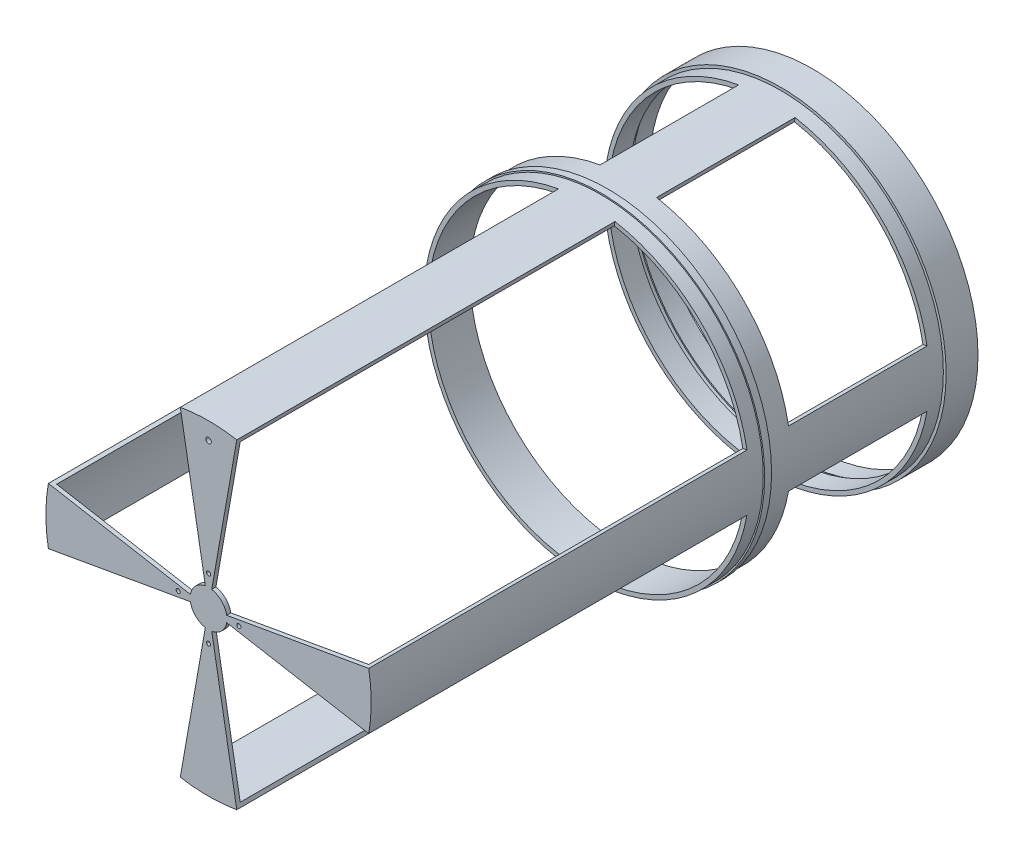
from build123d import *

# Parameters (mm, degrees)
SKETCH1_R       = 119.4
SKETCH1_R_2     = 114.4
EXTRUDE1_DEPTH  = 5
SKETCH2_R       = 119.4
SKETCH2_R_2     = 118.4
EXTRUDE2_DEPTH  = 5
SKETCH3_R       = 119.4
SKETCH3_R_2     = 117.4
EXTRUDE3_DEPTH  = 13
EXTRUDE4_START  = 10
SKETCH4_R       = 117.4
SKETCH4_R_2     = 114.4
EXTRUDE4_DEPTH  = 10
EXTRUDE5_START  = 100
EXTRUDE5_DEPTH  = 100
EXTRUDE7_START  = 15
SKETCH6_R       = 117.4
SKETCH6_R_2     = 114.4
EXTRUDE7_DEPTH  = 15
EXTRUDE8_START  = 5
SKETCH7_R       = 118.4
SKETCH7_R_2     = 114.4
EXTRUDE8_DEPTH  = 5
EXTRUDE9_START  = 10
SKETCH8_R       = 117.4
SKETCH8_R_2     = 114.4
EXTRUDE9_DEPTH  = 10
EXTRUDE10_START = 270
EXTRUDE10_DEPTH = 270
EXTRUDE11_START = 3
SKETCH10_R      = 1.5
SKETCH10_R_2    = 2
EXTRUDE11_DEPTH = 3


with BuildPart() as part:
    # Sketch1 → Extrude1 (new body)
    with BuildSketch(Plane.XY):
        Circle(SKETCH1_R)
        Circle(SKETCH1_R_2, mode=Mode.SUBTRACT)
    extrude(amount=-EXTRUDE1_DEPTH)

    # Sketch2 → Extrude2 (add)
    with BuildSketch(Plane(origin=(0, 0, -5), x_dir=(-1, 0, 0), z_dir=(0, 0, -1))):
        Circle(SKETCH2_R)
        Circle(SKETCH2_R_2, mode=Mode.SUBTRACT)
    extrude(amount=EXTRUDE2_DEPTH)

    # Sketch3 → Extrude3 (add)
    with BuildSketch(Plane(origin=(0, 0, -10), x_dir=(-1, 0, 0), z_dir=(0, 0, -1))):
        Circle(SKETCH3_R)
        Circle(SKETCH3_R_2, mode=Mode.SUBTRACT)
    extrude(amount=EXTRUDE3_DEPTH)

    # Sketch4 → Extrude4 (add)
    with BuildSketch(Plane.XY.offset(EXTRUDE4_START)):
        Circle(SKETCH4_R)
        Circle(SKETCH4_R_2, mode=Mode.SUBTRACT)
    extrude(amount=-EXTRUDE4_DEPTH)

    # Sketch5 → Extrude5 (add)
    with BuildSketch(Plane.XY.offset(10).offset(EXTRUDE5_START)):
        with BuildLine():
            Line((20.386296, 115.61643), (19.865352, 112.662007))
            ThreePointArc((19.865352, 112.662007), (0, 114.4), (-19.865352, 112.662007))
            Line((-19.865352, 112.662007), (-20.386296, 115.61643))
            ThreePointArc((-20.386296, 115.61643), (0, 117.4), (20.386296, 115.61643))
        make_face()
        with BuildLine():
            Line((115.61643, 20.386296), (112.662007, 19.865352))
            ThreePointArc((112.662007, 19.865352), (114.4, 0), (112.662007, -19.865352))
            Line((112.662007, -19.865352), (115.61643, -20.386296))
            ThreePointArc((115.61643, -20.386296), (117.4, 0), (115.61643, 20.386296))
        make_face()
        with BuildLine():
            Line((19.865352, -112.662007), (20.386296, -115.61643))
            ThreePointArc((20.386296, -115.61643), (0, -117.4), (-20.386296, -115.61643))
            Line((-20.386296, -115.61643), (-19.865352, -112.662007))
            ThreePointArc((-19.865352, -112.662007), (0, -114.4), (19.865352, -112.662007))
        make_face()
        with BuildLine():
            Line((-112.662007, -19.865352), (-115.61643, -20.386296))
            ThreePointArc((-115.61643, -20.386296), (-117.4, 0), (-115.61643, 20.386296))
            Line((-115.61643, 20.386296), (-112.662007, 19.865352))
            ThreePointArc((-112.662007, 19.865352), (-114.4, 0), (-112.662007, -19.865352))
        make_face()
    extrude(amount=-EXTRUDE5_DEPTH)

    # Sketch6 → Extrude7 (add)
    with BuildSketch(Plane.XY.offset(110).offset(EXTRUDE7_START)):
        Circle(SKETCH6_R)
        Circle(SKETCH6_R_2, mode=Mode.SUBTRACT)
    extrude(amount=-EXTRUDE7_DEPTH)

    # Sketch7 → Extrude8 (add)
    with BuildSketch(Plane.XY.offset(125).offset(EXTRUDE8_START)):
        Circle(SKETCH7_R)
        Circle(SKETCH7_R_2, mode=Mode.SUBTRACT)
    extrude(amount=-EXTRUDE8_DEPTH)

    # Sketch8 → Extrude9 (add)
    with BuildSketch(Plane.XY.offset(130).offset(EXTRUDE9_START)):
        Circle(SKETCH8_R)
        Circle(SKETCH8_R_2, mode=Mode.SUBTRACT)
    extrude(amount=-EXTRUDE9_DEPTH)

    # Sketch9 → Extrude10 (add)
    with BuildSketch(Plane.XY.offset(140).offset(EXTRUDE10_START)):
        with BuildLine():
            Line((-20.386296, 115.61643), (-19.865352, 112.662007))
            ThreePointArc((-19.865352, 112.662007), (0, 114.4), (19.865352, 112.662007))
            Line((19.865352, 112.662007), (20.386296, 115.61643))
            ThreePointArc((20.386296, 115.61643), (0, 117.4), (-20.386296, 115.61643))
        make_face()
        with BuildLine():
            Line((112.662007, 19.865352), (115.61643, 20.386296))
            ThreePointArc((115.61643, 20.386296), (117.4, 0), (115.61643, -20.386296))
            Line((115.61643, -20.386296), (112.662007, -19.865352))
            ThreePointArc((112.662007, -19.865352), (114.4, 0), (112.662007, 19.865352))
        make_face()
        with BuildLine():
            Line((19.865352, -112.662007), (20.386296, -115.61643))
            ThreePointArc((20.386296, -115.61643), (0, -117.4), (-20.386296, -115.61643))
            Line((-20.386296, -115.61643), (-19.865352, -112.662007))
            ThreePointArc((-19.865352, -112.662007), (0, -114.4), (19.865352, -112.662007))
        make_face()
        with BuildLine():
            Line((-112.662007, -19.865352), (-115.61643, -20.386296))
            ThreePointArc((-115.61643, -20.386296), (-117.4, 0), (-115.61643, 20.386296))
            Line((-115.61643, 20.386296), (-112.662007, 19.865352))
            ThreePointArc((-112.662007, 19.865352), (-114.4, 0), (-112.662007, -19.865352))
        make_face()
    extrude(amount=-EXTRUDE10_DEPTH)

    # Sketch10 → Extrude11 (add)
    with BuildSketch(Plane.XY.offset(410).offset(EXTRUDE11_START)):
        with BuildLine():
            Line((13.065229, 2.303752), (115.61643, 20.386296))
            ThreePointArc((115.61643, 20.386296), (117.4, 0), (115.61643, -20.386296))
            Line((115.61643, -20.386296), (13.065229, -2.303752))
            ThreePointArc((13.065229, -2.303752), (9.381031, -9.381031), (2.303752, -13.065229))
            Line((2.303752, -13.065229), (20.386296, -115.61643))
            ThreePointArc((20.386296, -115.61643), (0, -117.4), (-20.386296, -115.61643))
            Line((-20.386296, -115.61643), (-2.303752, -13.065229))
            ThreePointArc((-2.303752, -13.065229), (-9.381031, -9.381031), (-13.065229, -2.303752))
            Line((-13.065229, -2.303752), (-115.61643, -20.386296))
            ThreePointArc((-115.61643, -20.386296), (-117.4, 0), (-115.61643, 20.386296))
            Line((-115.61643, 20.386296), (-13.065229, 2.303752))
            ThreePointArc((-13.065229, 2.303752), (-9.381031, 9.381031), (-2.303752, 13.065229))
            Line((-2.303752, 13.065229), (-20.386296, 115.61643))
            ThreePointArc((-20.386296, 115.61643), (0, 117.4), (20.386296, 115.61643))
            Line((20.386296, 115.61643), (2.303752, 13.065229))
            ThreePointArc((2.303752, 13.065229), (9.381031, 9.381031), (13.065229, 2.303752))
        make_face()
        with Locations((21.92, 0)):
            Circle(SKETCH10_R, mode=Mode.SUBTRACT)
        with Locations((0, -21.92)):
            Circle(SKETCH10_R, mode=Mode.SUBTRACT)
        with Locations((-21.92, 0)):
            Circle(SKETCH10_R, mode=Mode.SUBTRACT)
        with Locations((0, 21.92)):
            Circle(SKETCH10_R, mode=Mode.SUBTRACT)
        with Locations((0, 105.043168)):
            Circle(SKETCH10_R_2, mode=Mode.SUBTRACT)
    extrude(amount=-EXTRUDE11_DEPTH)


solid = part.part
